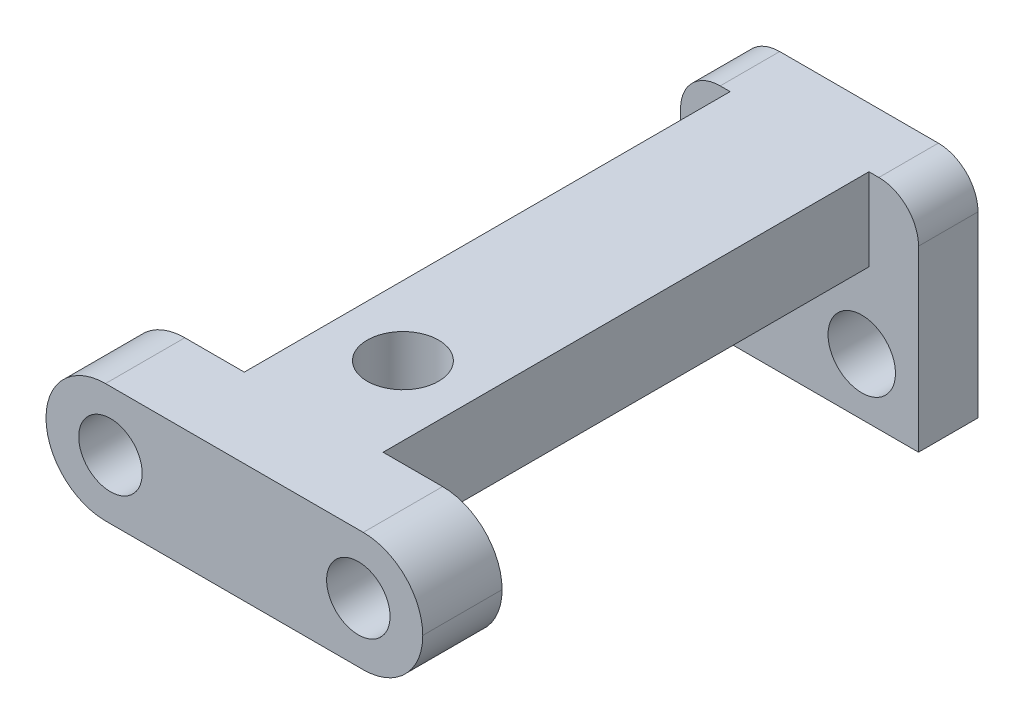
from build123d import *

# Parameters (mm, degrees)
BOSS_EXTRUDE1_DEPTH      = 28.5
SKETCH2_W                = 12
SKETCH2_H                = 11
SKETCH2_R                = 1.7
BOSS_EXTRUDE2_DEPTH      = 3
SKETCH3_W                = 19
SKETCH3_H                = 6
BOSS_EXTRUDE3_DEPTH      = 4
M3_CLEARANCE_HOLE1_D     = 3.2
M3_CLEARANCE_HOLE1_DEPTH = 4
FILLET1_R                = 3
M3_CLEARANCE_HOLE2_D     = 3.6
FILLET2_R                = 2


with BuildPart() as part:
    # Sketch1 → Boss-Extrude1 (new body)
    with BuildSketch(Plane.XY):
        with BuildLine():
            Line((-3.5, 44), (-3.5, 39.846580782))
            ThreePointArc((-3.5, 39.846580782), (0, 40), (3.5, 39.846580782))
            Line((3.5, 39.846580782), (3.5, 44))
            Line((3.5, 44), (-3.5, 44))
        make_face()
    extrude(amount=BOSS_EXTRUDE1_DEPTH)

    # Sketch2 → Boss-Extrude2 (add)
    with BuildSketch(Plane(origin=(0, 0, 0), x_dir=(-1, 0, 0), z_dir=(0, 0, -1))):
        with Locations((0, 38.5)):
            Rectangle(SKETCH2_W, SKETCH2_H)
        with Locations((-3.137606739, 35.863009131)):
            Circle(SKETCH2_R, mode=Mode.SUBTRACT)
        with Locations((3.137606739, 35.863009131)):
            Circle(SKETCH2_R, mode=Mode.SUBTRACT)
    extrude(amount=BOSS_EXTRUDE2_DEPTH)

    # Sketch3 → Boss-Extrude3 (add)
    with BuildSketch(Plane.XY.offset(28.5)):
        with Locations((0, 41)):
            Rectangle(SKETCH3_W, SKETCH3_H)
    extrude(amount=-BOSS_EXTRUDE3_DEPTH)

    # M3 Clearance Hole1
    with Locations(Plane.XY.offset(28.5)):
        with Locations((-6.25, 41), (6.25, 41)):
            Hole(M3_CLEARANCE_HOLE1_D / 2, depth=M3_CLEARANCE_HOLE1_DEPTH)

    # Fillet1
    fillet1_edges = [part.edges().sort_by_distance(p)[0] for p in [
        (9.5, 38, 26.5),
        (9.5, 44, 26.5),
        (-9.5, 38, 26.5),
        (-9.5, 44, 26.5),
    ]]
    fillet(fillet1_edges, radius=FILLET1_R - 0.0001)  # a hair under: the kernel refuses the full size

    # M3 Clearance Hole2 (through all)
    with Locations(Plane(origin=(0, 44, 0), x_dir=(1, 0, 0), z_dir=(0, 1, 0))):
        with Locations((0, -20)):
            Hole(M3_CLEARANCE_HOLE2_D / 2)

    # Fillet2
    fillet2_edges = [part.edges().sort_by_distance(p)[0] for p in [
        (6, 44, -1.5),
        (-6, 44, -1.5),
    ]]
    fillet(fillet2_edges, radius=FILLET2_R)


solid = part.part
